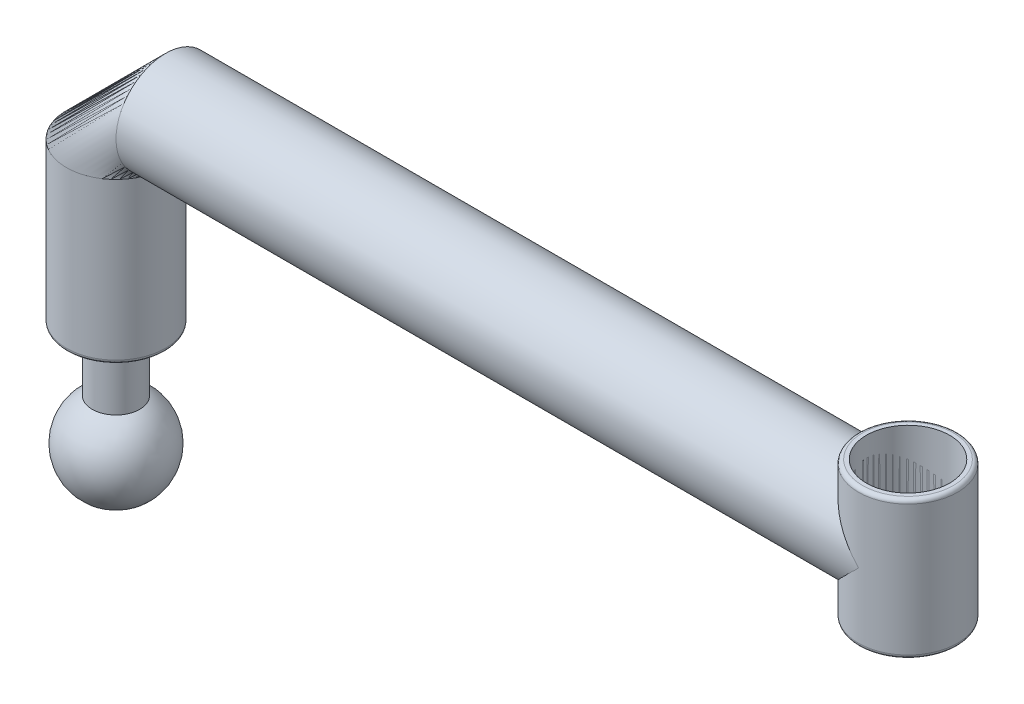
from build123d import *

# Parameters (mm, degrees)
SKETCH_2_R          = 6
EXTRUDE_1_DEPTH     = 26
SKETCH_3_R          = 12.5
SKETCH_6_R          = 12.5
SHELL_1_T           = -2
SKETCH_7_R          = 10.5
CUT_EXTRUDE_1_DEPTH = 226.860023029
FILLET_1_R          = 1
FILLET_2_R          = 1


with BuildPart() as part:
    # 草圖1 → 旋轉1 (revolve)
    with BuildSketch(Plane.XY):
        with BuildLine():
            Line((0, 12), (0, -12))
            ThreePointArc((0, -12), (12, 0), (0, 12))
        make_face()
    revolve(axis=Axis((0, 12, 0), (0, -1, 0)))

    # 草圖2 → 填料-伸長1 (add)
    with BuildSketch(Plane(origin=(0, 0, 0), x_dir=(1, 0, 0), z_dir=(0, 1, 0))):
        Circle(SKETCH_2_R)
    extrude(amount=EXTRUDE_1_DEPTH)


with BuildPart() as body_2:
    # 掃出1: sweep along a path in 草圖4
    with BuildLine(Plane.XY) as sweep_1_path:
        Line((0, 26), (0, 66.5))
        ThreePointArc((0, 66.5), (3.661165235, 75.338834765), (12.5, 79))
        Line((12.5, 79), (200, 79))
    # 草圖3 → 掃出1 (sweep)
    with BuildSketch(Plane(origin=(0, 26, 0), x_dir=(1, 0, 0), z_dir=(0, 1, 0))):
        Circle(SKETCH_3_R)
    sweep(path=sweep_1_path.line)

    # 草圖7 → 除料-伸長1 (cut, through all)
    with BuildSketch(Plane(origin=(0, 63.5, 0), x_dir=(1, 0, 0), z_dir=(0, 1, 0))):
        with Locations((200, 0)):
            Circle(SKETCH_7_R)
    extrude(amount=CUT_EXTRUDE_1_DEPTH, mode=Mode.SUBTRACT)

    # 圓角1
    fillet_1_edges = [body_2.edges().sort_by_distance(p)[0] for p in [
        (-12.5, 26, 0),
    ]]
    fillet(fillet_1_edges, radius=FILLET_1_R)


with BuildPart() as body_3:
    # 掃出2: sweep along a path in 草圖5
    with BuildLine(Plane.XY) as sweep_2_path:
        Line((200, 61.5), (200, 79))
        Line((200, 79), (200, 96.5))
    # 草圖6 → 掃出2 (sweep)
    with BuildSketch(Plane(origin=(0, 96.5, 0), x_dir=(1, 0, 0), z_dir=(0, 1, 0))):
        with Locations((200, 0)):
            Circle(SKETCH_6_R)
    sweep(path=sweep_2_path.line)

    # 薄殼1
    shell_1_openings = [body_3.faces().sort_by_distance(p)[0] for p in [
        (200, 96.5, 0),
    ]]
    offset(amount=SHELL_1_T, openings=shell_1_openings, kind=Kind.INTERSECTION)

    # 圓角2
    fillet_2_edges = [body_3.edges().sort_by_distance(p)[0] for p in [
        (187.5, 96.5, 0),
        (187.5, 61.5, 0),
    ]]
    fillet(fillet_2_edges, radius=FILLET_2_R)


solid = Compound([part.part, body_2.part, body_3.part])
